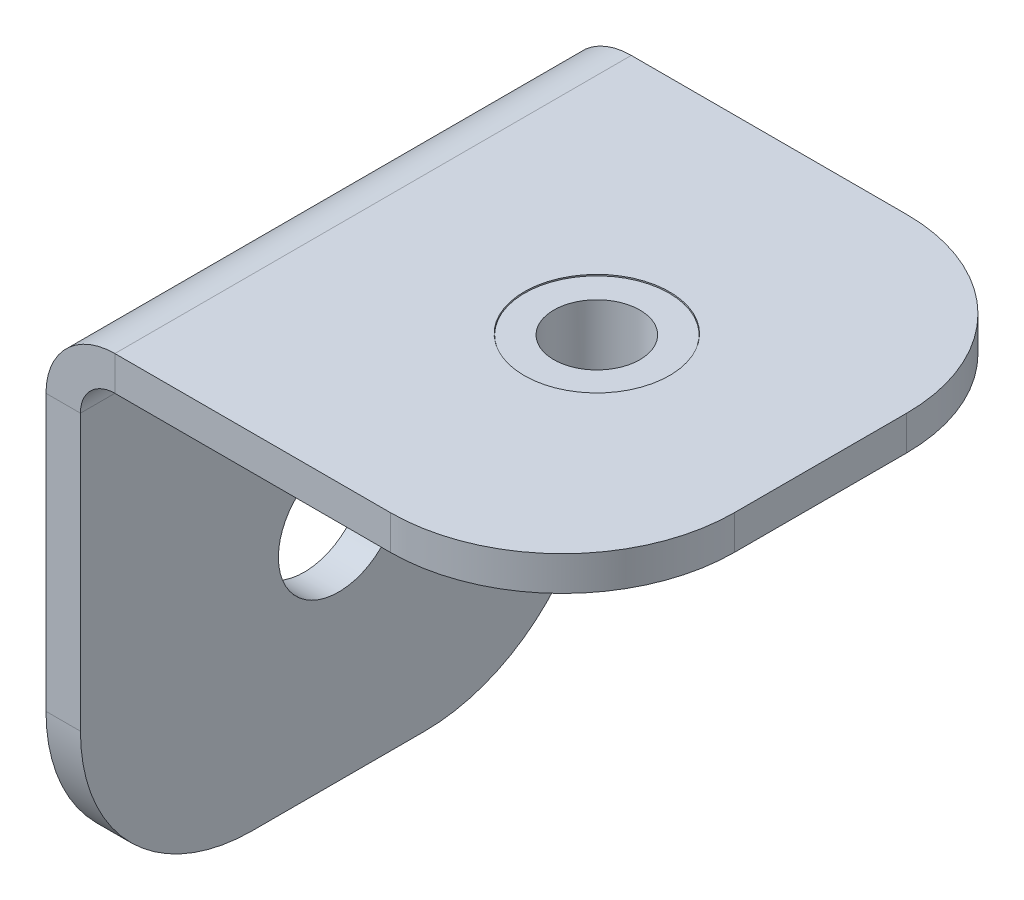
from build123d import *

# Parameters (mm, degrees)
BRIDA_BASE1_DEPTH          = 15
CORTAR_EXTRUIR1_REACH      = 27.981
CROQUIS2_R                 = 2.11
CORTAR_EXTRUIR2_REACH      = 27.981
CROQUIS3_R                 = 1.75
REDONDEO1_R                = 5
S_M3_1_START               = 6.057083137
S_M3_1_OUTLINE_R           = 3.15
S_M3_1_OUTLINE_R_2         = 1.25
S_M3_1_DEPTH               = 1.5
S_M3_1_START_2             = 5.087083137
S_M3_1_2_OUTLINE_R         = 2.1
S_M3_1_2_OUTLINE_R_2       = 1.25
S_M3_1_2_DEPTH             = 0.97
S_LIDO_MOVER_COPIAR2_ANGLE = 180


with BuildPart() as part:
    # Brida base1: sheet metal written as solids
    # Croquis1 → Brida base1 (new body)
    with BuildSketch(Plane.XY):
        with BuildLine():
            Line((0, 0), (0, 13))
            ThreePointArc((0, 13), (0.585786438, 14.414213562), (2, 15))
            Line((2, 15), (15, 15))
            Line((15, 15), (15, 14))
            Line((15, 14), (2, 14))
            ThreePointArc((2, 14), (1.292893219, 13.707106781), (1, 13))
            Line((1, 13), (1, 0))
            Line((1, 0), (0, 0))
        make_face()
    extrude(amount=BRIDA_BASE1_DEPTH)

    # Croquis2 → Cortar-Extruir1 (cut, up to next)
    with BuildSketch(Plane(origin=(0, 15, 0), x_dir=(1, 0, 0), z_dir=(0, 1, 0)), mode=Mode.PRIVATE) as cortar_extruir1_sk1:
        with Locations(Location((8.5, -7.5, 0), (0, 0, 270))):
            Circle(CROQUIS2_R)
    cortar_extruir1_tool1 = extrude(cortar_extruir1_sk1.sketch, amount=-CORTAR_EXTRUIR1_REACH, mode=Mode.PRIVATE) & part.part
    add(cortar_extruir1_tool1.solids().sort_by_distance((8.5, 15, 7.5))[0], mode=Mode.SUBTRACT)

    # Croquis3 → Cortar-Extruir2 (cut, up to next)
    with BuildSketch(Plane.ZY, mode=Mode.PRIVATE) as cortar_extruir2_sk1:
        with Locations((7.5, 6.5)):
            Circle(CROQUIS3_R)
    cortar_extruir2_tool1 = extrude(cortar_extruir2_sk1.sketch, amount=-CORTAR_EXTRUIR2_REACH, mode=Mode.PRIVATE) & part.part
    add(cortar_extruir2_tool1.solids().sort_by_distance((0, 6.5, 7.5))[0], mode=Mode.SUBTRACT)

    # Redondeo1
    redondeo1_edges = [part.edges().sort_by_distance(p)[0] for p in [
        (0.5, 0, 15),
        (15, 14.5, 15),
        (0.5, 0, 0),
        (15, 14.5, 0),
    ]]
    fillet(redondeo1_edges, radius=REDONDEO1_R)


with BuildPart() as body_2:
    # S-M3-1: read off the stored shape, not the designer's step
    # S-M3-1 outline → S-M3-1 (new body)
    with BuildSketch(Plane(origin=(0, 0, 0), x_dir=(1, 0, 0), z_dir=(0, 1, 0)).offset(S_M3_1_START)):
        with Locations((5.193353816, 2.598352405)):
            Circle(S_M3_1_OUTLINE_R)
        with Locations((5.193353816, 2.598352405)):
            Circle(S_M3_1_OUTLINE_R_2, mode=Mode.SUBTRACT)
    extrude(amount=S_M3_1_DEPTH)

    # S-M3-1 2 outline → S-M3-1 2 (add)
    with BuildSketch(Plane(origin=(0, 0, 0), x_dir=(1, 0, 0), z_dir=(0, 1, 0)).offset(S_M3_1_START_2)):
        with Locations((5.193353816, 2.598352405)):
            Circle(S_M3_1_2_OUTLINE_R)
        with Locations((5.193353816, 2.598352405)):
            Circle(S_M3_1_2_OUTLINE_R_2, mode=Mode.SUBTRACT)
    extrude(amount=S_M3_1_2_DEPTH)


with BuildPart() as body_2_1:
    # Sólido-Mover/Copiar2: read off the stored shape, not the designer's step
    # Sólido-Mover/Copiar2: moved
    add(body_2.part.moved(Location((6.0246646, -20.0570831, 0.9686093))).rotate(Axis((0, 0, 0), (0.9584281675, 0, 0.2853339234)), S_LIDO_MOVER_COPIAR2_ANGLE))


solid = Compound([part.part, body_2_1.part])
